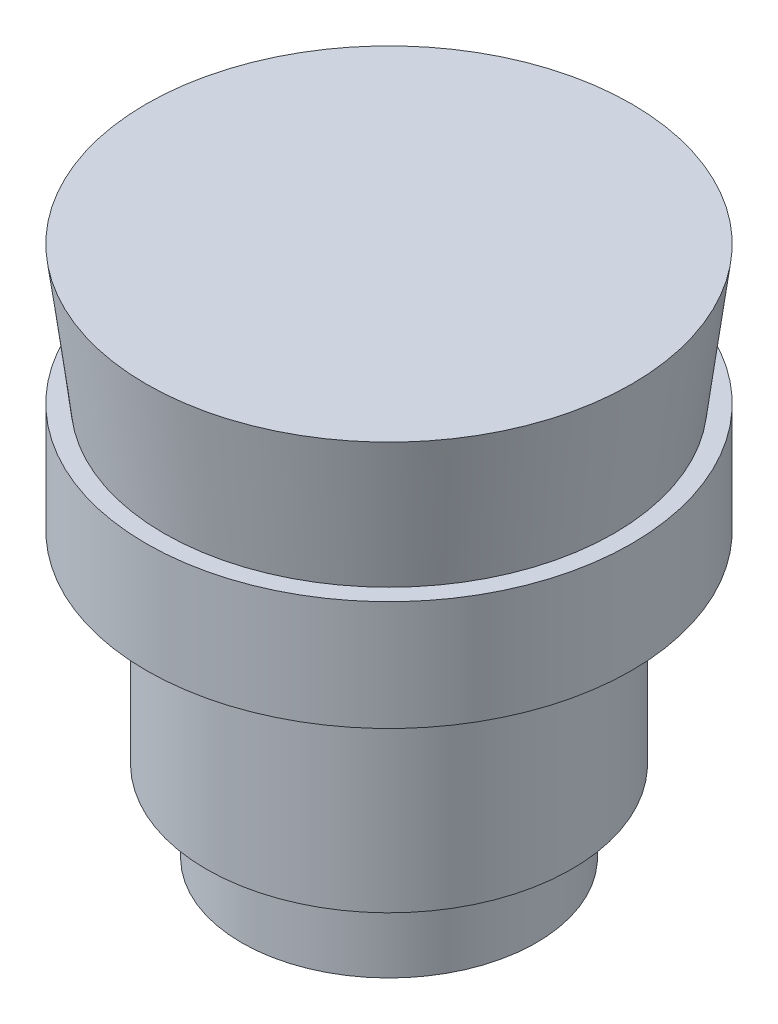
from build123d import *


with BuildPart() as part:
    # Sketch1 → Revolve1 (revolve)
    with BuildSketch(Plane(origin=(0, 0, 0), x_dir=(0, 0, -1), z_dir=(1, 0, 0))):
        Polygon((0, 17.78), (-17.399, 17.78), (-16.129, 7.874), (-17.399, 7.874), (-17.399, 0), (-13.1064, 0), (-13.1064, -14.478), (-10.5664, -14.478), (-10.5664, -20.32), (0, -20.32), align=None)
    revolve(axis=Axis((0, 17.78, 0), (0, -1, 0)))


solid = part.part
